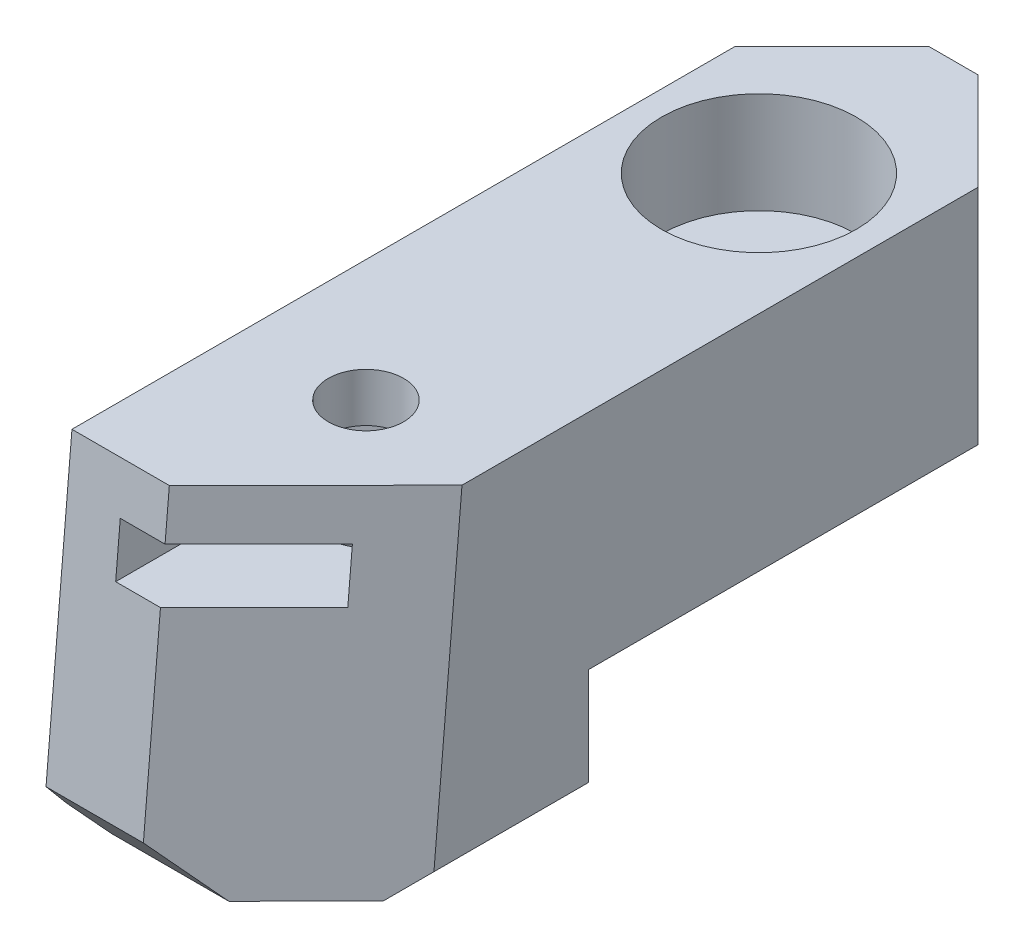
from build123d import *

# Parameters (mm, degrees)
SKETCH1_W             = 25.4
SKETCH1_H             = 9.525
BOSS_EXTRUDE1_DEPTH   = 7.9375
BOSS_EXTRUDE2_DEPTH   = 15.875
CHAMFER1_SIZE         = 6.35
CHAMFER2_SIZE         = 3.175
CHAMFER2_SIZE2        = 2.93072295
F_8_CLEARANCE_HOLE1_D = 4.9149
CHAMFER3_SIZE         = 1.5875
BOSS_EXTRUDE3_DEPTH   = 3.429
BOSS_EXTRUDE4_START   = 3.175
SKETCH6_W             = 15.875
SKETCH6_H             = 20.446862299
SKETCH6_R             = 2.45745
BOSS_EXTRUDE4_DEPTH   = 3.175
SKETCH7_R             = 6.35
BOSS_EXTRUDE5_DEPTH   = 6.604
CUT_EXTRUDE1_DEPTH    = 44.214477453
CHAMFER5_SIZE         = 9.525


with BuildPart() as part:
    # Sketch1 → Boss-Extrude1 (new, symmetric)
    with BuildSketch(Plane(origin=(0, 0, 0), x_dir=(0, 0, -1), z_dir=(1, 0, 0))):
        Rectangle(SKETCH1_W, SKETCH1_H)
    extrude(amount=BOSS_EXTRUDE1_DEPTH, both=True)

    # Sketch2 → Boss-Extrude2 (add, through all)
    with BuildSketch(Plane.ZY.offset(7.9375)):
        Polygon((12.7, 4.7625), (37.438033761, 4.7625), (38.828997162, -11.13628443), (12.7, -11.13628443), align=None)
    extrude(amount=-BOSS_EXTRUDE2_DEPTH)

    # Chamfer1
    chamfer1_edges = [part.edges().sort_by_distance(p)[0] for p in [
        (7.9375, 0, -12.7),
        (7.9375, -7.949392215, 12.7),
        (-7.9375, -7.949392215, 12.7),
        (-7.9375, 0, -12.7),
    ]]
    chamfer(chamfer1_edges, length=CHAMFER1_SIZE)

    # Chamfer2
    chamfer2_edges = [part.edges().sort_by_distance(p)[0] for p in [
        (0, -11.13628443, 38.828997162),
    ]]
    chamfer2_side = [part.faces().sort_by_distance(p)[0] for p in [
        (0, -3.186892215, 38.133515462),
    ]]
    chamfer(chamfer2_edges, length=CHAMFER2_SIZE, length2=CHAMFER2_SIZE2, reference=chamfer2_side[0])

    # #8 Clearance Hole1 (through all)
    with Locations(Plane(origin=(0, -11.13628443, 0), x_dir=(-1, 0, 0), z_dir=(0, -1, 0))):
        with Locations((0, -25.62613884), (0, 0)):
            Hole(F_8_CLEARANCE_HOLE1_D / 2)

    # Chamfer3
    chamfer3_edges = [part.edges().sort_by_distance(p)[0] for p in [
        (0, -11.13628443, 12.7),
        (-7.9375, -11.13628443, 27.474137106),
        (7.9375, -11.13628443, 27.474137106),
        (-4.7625, -11.13628443, 15.875),
        (4.7625, -11.13628443, 15.875),
        (0, -4.7625, -12.7),
        (-4.7625, -4.7625, -9.525),
        (4.7625, -4.7625, -9.525),
        (-7.9375, -4.7625, 6.35),
        (7.9375, -4.7625, 6.35),
    ]]
    chamfer(chamfer3_edges, length=CHAMFER3_SIZE)

    # Sketch5 → Boss-Extrude3 (add)
    with BuildSketch(Plane(origin=(0, 4.7625, 0), x_dir=(1, 0, 0), z_dir=(0, 1, 0))):
        Polygon((4.5085, -37.438033761), (4.5085, -23.023155151), (0, -20.420171462), (-4.5085, -23.023155151), (-4.5085, -37.438033761), (-7.9375, -37.438033761), (-7.9375, -16.991171462), (7.9375, -16.991171462), (7.9375, -37.438033761), align=None)
    extrude(amount=BOSS_EXTRUDE3_DEPTH)

    # Sketch6 → Boss-Extrude4 (add)
    with BuildSketch(Plane(origin=(0, 8.1915, 0), x_dir=(1, 0, 0), z_dir=(0, 1, 0)).offset(BOSS_EXTRUDE4_START)):
        with Locations((0, -27.214602611)):
            Rectangle(SKETCH6_W, SKETCH6_H)
        with Locations(Location((0, -25.62613884, 0), (0, 0, 90))):
            Circle(SKETCH6_R, mode=Mode.SUBTRACT)
    extrude(amount=-BOSS_EXTRUDE4_DEPTH)

    # Sketch7 → Boss-Extrude5 (add)
    with BuildSketch(Plane(origin=(0, 4.7625, 0), x_dir=(1, 0, 0), z_dir=(0, 1, 0))):
        Polygon((-7.9375, 6.35), (-7.9375, -16.991171462), (7.9375, -16.991171462), (7.9375, 6.35), (1.5875, 12.7), (-1.5875, 12.7), align=None)
        with Locations(Location((0, 0, 0), (0, 0, 270))):
            Circle(SKETCH7_R, mode=Mode.SUBTRACT)
    extrude(amount=BOSS_EXTRUDE5_DEPTH)

    # Sketch8 → Cut-Extrude1 (cut, through all)
    with BuildSketch(Plane.ZY.offset(7.9375)):
        Polygon((37.438033761, 4.7625), (36.860258627, 11.3665), (37.438033761, 11.3665), align=None)
    extrude(amount=-CUT_EXTRUDE1_DEPTH, mode=Mode.SUBTRACT)

    # Chamfer5
    # the kernel refuses this chamfer: 9.525 mm, written as the material it takes off along each edge
    with BuildSketch(Plane(origin=(7.9375, -32.375434787, 40.687182042), x_dir=(0.027495876610586376, -0.08712279063518516, -0.9958180537233462), z_dir=(0, 0.9961946980917505, -0.0871557427476014))) as chamfer5_piece_1:
        Polygon((CHAMFER5_SIZE * 0.999621916911, CHAMFER5_SIZE * 0.0274958766106), (-CHAMFER5_SIZE * 0.0274958766106, CHAMFER5_SIZE * 0.999621916911), (0, 0), align=None)
    extrude(amount=68.404302332, mode=Mode.SUBTRACT)


solid = part.part
